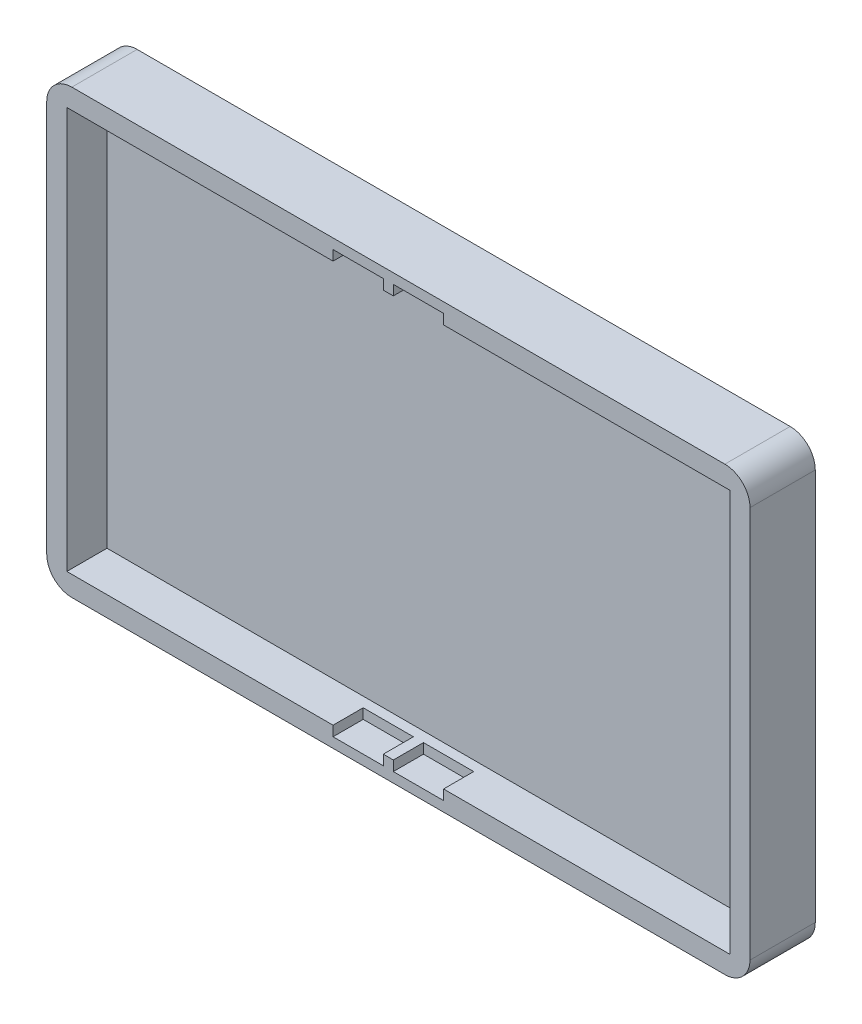
from build123d import *

# Parameters (mm, degrees)
SKETCH1_W               = 70
SKETCH1_H               = 44
BOSS_EXTRUDE1_DEPTH     = 6.5
SKETCH2_W               = 66
SKETCH2_H               = 40
CUT_EXTRUDE1_DEPTH      = 4
CUT_EXTRUDE2_DEPTH      = 41
CUT_EXTRUDE2_DEPTH_BACK = 1
SKETCH4_W               = 5
SKETCH4_H               = 2
CORNER_FILLET_R         = 2.5
SKETCH5_W               = 5
SKETCH5_H               = 1
CUT_EXTRUDE3_DEPTH      = 1
SKETCH6_W               = 5
SKETCH6_H               = 1
CUT_EXTRUDE4_DEPTH      = 1
SKETCH7_W               = 5
SKETCH7_H               = 1
CUT_EXTRUDE5_DEPTH      = 1
SKETCH8_W               = 5
SKETCH8_H               = 1
CUT_EXTRUDE6_DEPTH      = 1


with BuildPart() as part:
    # Sketch1 → Boss-Extrude1 (new body)
    with BuildSketch(Plane.XY):
        with Locations((35, 22)):
            Rectangle(SKETCH1_W, SKETCH1_H)
    extrude(amount=BOSS_EXTRUDE1_DEPTH)

    # Sketch2 → Cut-Extrude1 (cut)
    with BuildSketch(Plane.XY.offset(6.5)):
        with Locations((35, 22)):
            Rectangle(SKETCH2_W, SKETCH2_H)
    extrude(amount=-CUT_EXTRUDE1_DEPTH, mode=Mode.SUBTRACT)

    # Sketch4 → Cut-Extrude2 (cut, two sides: drawn at the far end of the back side and taken through both)
    with BuildSketch(Plane.XZ.offset(-42).offset(-CUT_EXTRUDE2_DEPTH_BACK)):
        with Locations((31, 4.5)):
            Rectangle(SKETCH4_W, SKETCH4_H)
        with Locations((37, 4.5)):
            Rectangle(SKETCH4_W, SKETCH4_H)
    extrude(amount=CUT_EXTRUDE2_DEPTH + CUT_EXTRUDE2_DEPTH_BACK, mode=Mode.SUBTRACT)

    # Corner Fillet
    corner_fillet_edges = [part.edges().sort_by_distance(p)[0] for p in [
        (0, 44, 3.25),
        (0, 0, 3.25),
        (70, 0, 3.25),
        (70, 44, 3.25),
    ]]
    fillet(corner_fillet_edges, radius=CORNER_FILLET_R)

    # Sketch5 → Cut-Extrude3 (cut)
    with BuildSketch(Plane(origin=(0, 2, 0), x_dir=(1, 0, 0), z_dir=(0, 1, 0))):
        with Locations((31, -6)):
            Rectangle(SKETCH5_W, SKETCH5_H)
    extrude(amount=-CUT_EXTRUDE3_DEPTH, mode=Mode.SUBTRACT)

    # Sketch6 → Cut-Extrude4 (cut)
    with BuildSketch(Plane.XZ.offset(-42)):
        with Locations((37, 6)):
            Rectangle(SKETCH6_W, SKETCH6_H)
    extrude(amount=-CUT_EXTRUDE4_DEPTH, mode=Mode.SUBTRACT)

    # Sketch7 → Cut-Extrude5 (cut)
    with BuildSketch(Plane(origin=(0, 2, 0), x_dir=(1, 0, 0), z_dir=(0, 1, 0))):
        with Locations((37, -6)):
            Rectangle(SKETCH7_W, SKETCH7_H)
    extrude(amount=-CUT_EXTRUDE5_DEPTH, mode=Mode.SUBTRACT)

    # Sketch8 → Cut-Extrude6 (cut)
    with BuildSketch(Plane.XZ.offset(-42)):
        with Locations((31, 6)):
            Rectangle(SKETCH8_W, SKETCH8_H)
    extrude(amount=-CUT_EXTRUDE6_DEPTH, mode=Mode.SUBTRACT)


solid = part.part
